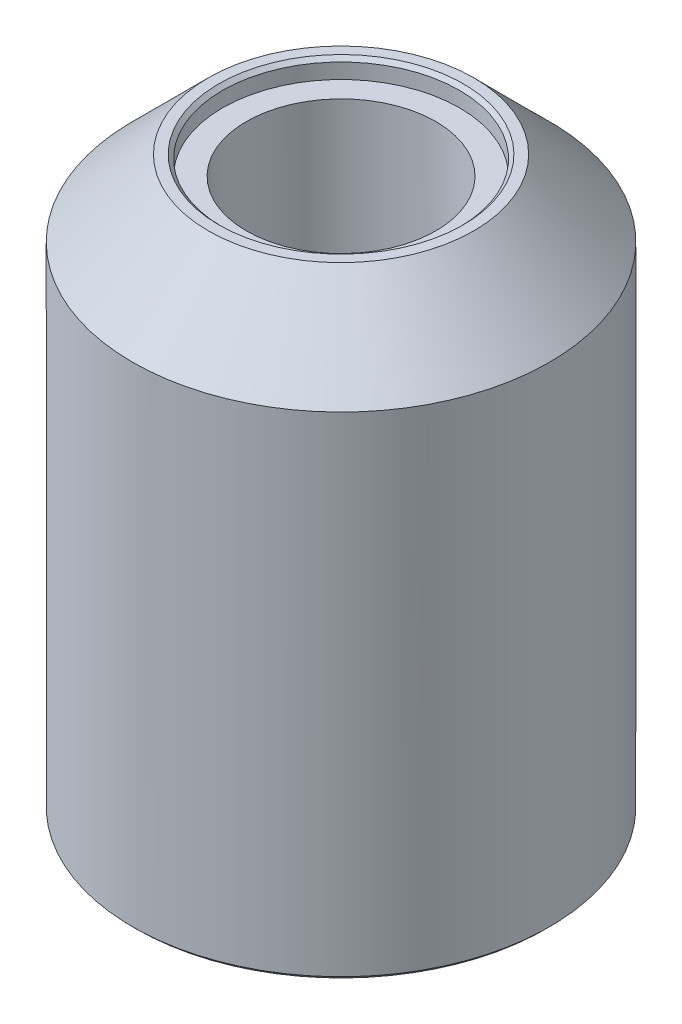
from build123d import *

# Parameters (mm, degrees)
SKETCH2_R               = 13.97
BOSS_EXTRUDE1_DEPTH     = 38.1
CHAMFER1_SIZE           = 5.08
SKETCH4_R               = 6.35
CUT_EXTRUDE1_DEPTH      = 127
SKETCH5_R               = 7.9375
CUT_EXTRUDE2_DEPTH      = 1.27
CUT_EXTRUDE3_START      = -1.27
SKETCH6_R               = 7.9375
CUT_EXTRUDE3_DEPTH      = 1.27
SKETCH8_W               = 3.81
SKETCH8_H               = 23.495
CUT_EXTRUDE4_DEPTH      = 12.7
SKETCH9_W               = 12.7
SKETCH9_H               = 0.508
CUT_EXTRUDE5_DEPTH      = 9.525
SKETCH10_R              = 1.5875
CUT_EXTRUDE6_DEPTH      = 2.54
SKETCH11_R              = 3.175
CUT_EXTRUDE7_DEPTH      = 6.35
SKETCH12_R              = 3.0226
CUT_EXTRUDE8_DEPTH      = 4.064
CIRPATTERN1_COUNT       = 4
CUT_EXTRUDE9_REACH      = 47.27
CUT_EXTRUDE9_END_RADIUS = 6.35
SKETCH13_R              = 1.27
CIRPATTERN2_START       = -6.096
CIRPATTERN2_OUTLINE_R   = 1.27
CIRPATTERN2_DEPTH       = 6.096
CHAMFER2_SIZE           = 0.254


with BuildPart() as part:
    # Sketch2 → Boss-Extrude1 (new body)
    with BuildSketch(Plane(origin=(0, 0, 0), x_dir=(1, 0, 0), z_dir=(0, 1, 0))):
        with Locations(Location((0, 0, 0), (0, 0, 90))):
            Circle(SKETCH2_R)
    extrude(amount=BOSS_EXTRUDE1_DEPTH)

    # Chamfer1
    chamfer1_edges = [part.edges().sort_by_distance(p)[0] for p in [
        (0, 38.1, 13.97),
    ]]
    chamfer(chamfer1_edges, length=CHAMFER1_SIZE)

    # Sketch4 → Cut-Extrude1 (cut)
    with BuildSketch(Plane.XZ):
        with Locations(Location((0, 0, 0), (0, 0, 270))):
            Circle(SKETCH4_R)
    extrude(amount=-CUT_EXTRUDE1_DEPTH, mode=Mode.SUBTRACT)

    # Sketch5 → Cut-Extrude2 (cut)
    with BuildSketch(Plane(origin=(0, 38.1, 0), x_dir=(1, 0, 0), z_dir=(0, 1, 0))):
        with Locations(Location((0, 0, 0), (0, 0, 270))):
            Circle(SKETCH5_R)
    extrude(amount=-CUT_EXTRUDE2_DEPTH, mode=Mode.SUBTRACT)

    # Sketch6 → Cut-Extrude3 (cut)
    with BuildSketch(Plane.XZ.offset(CUT_EXTRUDE3_START)):
        with Locations(Location((0, 0, 0), (0, 0, 90))):
            Circle(SKETCH6_R)
    extrude(amount=CUT_EXTRUDE3_DEPTH, mode=Mode.SUBTRACT)

    # Sketch8 → Cut-Extrude4 (cut, symmetric)
    with BuildSketch(Plane(origin=(0, 0, 0), x_dir=(0, 0, -1), z_dir=(1, 0, 0))):
        with Locations((12.065, 19.1135)):
            Rectangle(SKETCH8_W, SKETCH8_H)
    extrude(amount=CUT_EXTRUDE4_DEPTH, both=True, mode=Mode.SUBTRACT)

    # Sketch9 → Cut-Extrude5 (cut, symmetric)
    with BuildSketch(Plane(origin=(0, 0, 0), x_dir=(1, 0, 0), z_dir=(0, 1, 0))):
        with Locations((0, 13.97)):
            Rectangle(SKETCH9_W, SKETCH9_H)
    extrude(amount=CUT_EXTRUDE5_DEPTH, both=True, mode=Mode.SUBTRACT)

    # Sketch10 → Cut-Extrude6 (cut, symmetric)
    with BuildSketch(Plane(origin=(0, 0, -13.716), x_dir=(-1, 0, 0), z_dir=(0, 0, -1))):
        with Locations((0, 3.683)):
            Circle(SKETCH10_R)
    extrude(amount=CUT_EXTRUDE6_DEPTH, both=True, mode=Mode.SUBTRACT)

    # Sketch11 → Cut-Extrude7 (cut, symmetric)
    with BuildSketch(Plane(origin=(0, 0, -10.16), x_dir=(-1, 0, 0), z_dir=(0, 0, -1))):
        with Locations(Location((0, 19.1135, 0), (0, 0, 270))):
            Circle(SKETCH11_R)
    extrude(amount=CUT_EXTRUDE7_DEPTH, both=True, mode=Mode.SUBTRACT)

    # Sketch12 → Cut-Extrude8 (cut)
    with BuildSketch(Plane(origin=(0, 0, -10.16), x_dir=(-1, 0, 0), z_dir=(0, 0, -1))):
        with Locations(Location((4.939140867, 24.052640867, 0), (0, 0, 90))):
            Circle(SKETCH12_R)
    cut_extrude8 = extrude(amount=-CUT_EXTRUDE8_DEPTH, mode=Mode.SUBTRACT)

    # CirPattern1: Cut-Extrude8 ×4 about axis
    cirpattern1_axis = Axis((0, 19.1135, 0), (0, 0, 1))
    for i in range(1, CIRPATTERN1_COUNT):
        add(cut_extrude8.rotate(cirpattern1_axis, i * 360 / CIRPATTERN1_COUNT), mode=Mode.SUBTRACT)

    # Cut-Extrude9: up to this cylinder (the profile starts outside it)
    cut_extrude9_end = Plane(origin=(0, 14.174359, 0), z_dir=(0, -1, 0)) * Cylinder(CUT_EXTRUDE9_END_RADIUS, 108.24, mode=Mode.PRIVATE)
    # Sketch13 → Cut-Extrude9 (cut, up to the surface)
    with BuildSketch(Plane(origin=(0, 0, -6.096), x_dir=(-1, 0, 0), z_dir=(0, 0, -1)), mode=Mode.PRIVATE) as cut_extrude9_sk1:
        with Locations((4.939140867, 14.174359133)):
            Circle(SKETCH13_R)
    cut_extrude9_tool1 = extrude(cut_extrude9_sk1.sketch, amount=-CUT_EXTRUDE9_REACH, mode=Mode.PRIVATE) - cut_extrude9_end
    add(cut_extrude9_tool1.solids().sort_by_distance((-4.939141, 14.174359, -6.096))[0], mode=Mode.SUBTRACT)

    # CirPattern2: read off the stored shape, not the designer's step
    # CirPattern2 outline → CirPattern2 (cut)
    with BuildSketch(Plane.XY.offset(CIRPATTERN2_START)):
        with Locations((-4.939140867, 24.052640867)):
            Circle(CIRPATTERN2_OUTLINE_R)
        with Locations((4.939140867, 24.052640867)):
            Circle(CIRPATTERN2_OUTLINE_R)
        with Locations((4.939140867, 14.174359133)):
            Circle(CIRPATTERN2_OUTLINE_R)
    extrude(amount=CIRPATTERN2_DEPTH, mode=Mode.SUBTRACT)

    # Chamfer2
    chamfer2_edges = [part.edges().sort_by_distance(p)[0] for p in [
        (0, 38.1, -7.9375),
        (0, 0, -7.9375),
        (0, 0, 13.97),
        (0, 0, -13.716),
        (1.5875, 3.683, -13.716),
        (0, 22.2885, -10.16),
        (-4.939140867, 21.030040867, -10.16),
        (-1.916540867, 14.174359133, -10.16),
        (4.939140867, 17.196959133, -10.16),
        (1.916540867, 24.052640867, -10.16),
    ]]
    chamfer(chamfer2_edges, length=CHAMFER2_SIZE - 0.0001)  # a hair under: the kernel refuses the full size


solid = part.part
